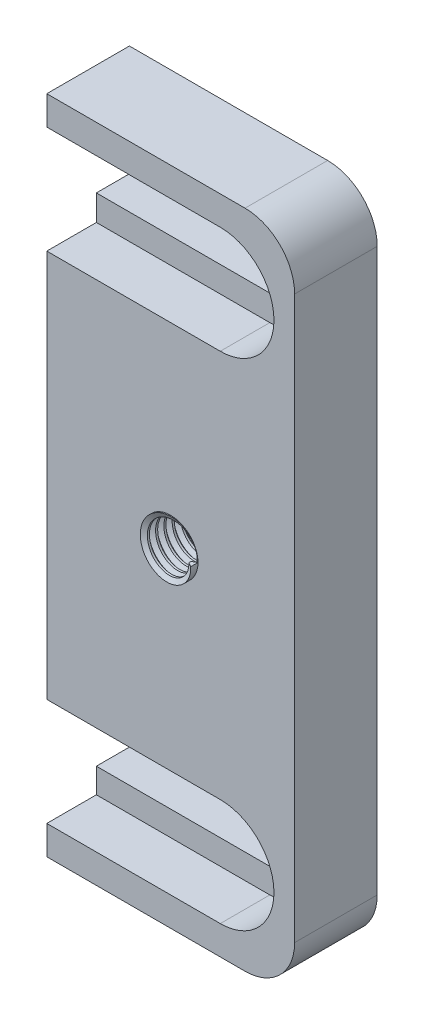
from build123d import *

# Parameters (mm, degrees)
SKETCH1_W             = 15
SKETCH1_H             = 40
BOSS_EXTRUDE1_DEPTH   = 5
CUT_EXTRUDE1_DEPTH    = 3
CUT_EXTRUDE2_DEPTH    = 43.825226211
CUT_EXTRUDE3_DEPTH    = 3
CUT_EXTRUDE4_DEPTH    = 44.011626335
F_4_CLEARANCE_HOLE1_D = 3.3
FILLET1_R             = 3
THREAD_1_PITCH        = 0.5


with BuildPart() as part:
    # Sketch1 → Boss-Extrude1 (new body)
    with BuildSketch(Plane.XY.offset(5)):
        with Locations((7.5, -20)):
            Rectangle(SKETCH1_W, SKETCH1_H)
    extrude(amount=-BOSS_EXTRUDE1_DEPTH)

    # Sketch2 → Cut-Extrude1 (cut)
    with BuildSketch(Plane.XY.offset(5)):
        with BuildLine():
            Line((0, -8.25), (10.5, -8.25))
            ThreePointArc((10.5, -8.25), (13.75, -5), (10.5, -1.75))
            Line((10.5, -1.75), (0, -1.75))
            Line((0, -1.75), (0, -8.25))
        make_face()
    extrude(amount=-CUT_EXTRUDE1_DEPTH, mode=Mode.SUBTRACT)

    # Sketch3 → Cut-Extrude2 (cut, through all)
    with BuildSketch(Plane.XY.offset(2)):
        with BuildLine():
            Line((0, -3.3), (0, -6.7))
            Line((0, -6.7), (10.5, -6.7))
            ThreePointArc((10.5, -6.7), (12.2, -5), (10.5, -3.3))
            Line((10.5, -3.3), (0, -3.3))
        make_face()
    extrude(amount=-CUT_EXTRUDE2_DEPTH, mode=Mode.SUBTRACT)

    # Sketch4 → Cut-Extrude3 (cut)
    with BuildSketch(Plane.XY.offset(5)):
        with BuildLine():
            Line((0, -38.25), (10.5, -38.25))
            ThreePointArc((10.5, -38.25), (13.75, -35), (10.5, -31.75))
            Line((10.5, -31.75), (0, -31.75))
            Line((0, -31.75), (0, -38.25))
        make_face()
    extrude(amount=-CUT_EXTRUDE3_DEPTH, mode=Mode.SUBTRACT)

    # Sketch5 → Cut-Extrude4 (cut, through all)
    with BuildSketch(Plane(origin=(0, 0, 0), x_dir=(-1, 0, 0), z_dir=(0, 0, -1))):
        with BuildLine():
            Line((0, -36.75), (0, -33.25))
            Line((0, -33.25), (-10.5, -33.25))
            ThreePointArc((-10.5, -33.25), (-12.25, -35), (-10.5, -36.75))
            Line((-10.5, -36.75), (0, -36.75))
        make_face()
    extrude(amount=-CUT_EXTRUDE4_DEPTH, mode=Mode.SUBTRACT)

    # #4 Clearance Hole1 (through all)
    with Locations(Plane.XY.offset(5)):
        with Locations((7.5, -20)):
            Hole(F_4_CLEARANCE_HOLE1_D / 2)

    # Fillet1
    fillet1_edges = [part.edges().sort_by_distance(p)[0] for p in [
        (15, -40, 2.5),
        (15, 0, 2.5),
    ]]
    fillet(fillet1_edges, radius=FILLET1_R)

    # 螺纹线1: the profile of 螺纹线轮廓2 profile screwed along a right-hand helix of 10 turns, 6 arcs to a turn; built about Z, then put on its axis
    thread_1_z = Axis((0, 0, 0), (0, 0, 1))
    thread_1_corners = [(1.6503, 0, -0.000173205), (1.6503, 0, 0.437673204), (1.379367063, 0, 0.281249999), (1.379367063, 0, 0.156249999)]
    with BuildLine(mode=Mode.PRIVATE) as thread_1_profile:
        Line(thread_1_corners[0], thread_1_corners[1])
        Line(thread_1_corners[1], thread_1_corners[2])
        Line(thread_1_corners[2], thread_1_corners[3])
        Line(thread_1_corners[3], thread_1_corners[0])
    thread_1_cap = Face(thread_1_profile.wire())
    thread_1_turn_angles = [0, 30, 60, 90, 120, 150, 180, 210, 240, 270, 300, 330, 360]
    thread_1_turn_weights = [1, 0.8660254037844387, 1, 0.8660254037844387, 1, 0.8660254037844387, 1, 0.8660254037844387, 1, 0.8660254037844387, 1, 0.8660254037844387, 1]
    thread_1_turn_rails = [Edge.make_bspline([Vector(p[0], p[1], 0).rotate(thread_1_z, thread_1_turn_angles[k]) / thread_1_turn_weights[k] + Vector(0, 0, p[2] + THREAD_1_PITCH * thread_1_turn_angles[k] / 360) for k in range(13)], [0, 0, 0, 1, 1, 2, 2, 3, 3, 4, 4, 5, 5, 6, 6, 6], 2, thread_1_turn_weights) for p in thread_1_corners]
    thread_1_turn_sides = [Face.make_surface_from_curves(thread_1_turn_rails[p[0]], thread_1_turn_rails[p[1]]) for p in [(0, 1), (1, 2), (2, 3), (3, 0)]]
    thread_1 = Plane(origin=(7.5, -20, 0), x_dir=(1, 0, 0), z_dir=(0, 0, 1)) * Solid(Shell([*[p.moved(Location((0, 0, THREAD_1_PITCH * i))) for i in range(10) for p in thread_1_turn_sides], thread_1_cap, thread_1_cap.rotate(thread_1_z, 3600).moved(Location((0, 0, THREAD_1_PITCH * 3600 / 360)))]))
    add(thread_1)


solid = part.part
